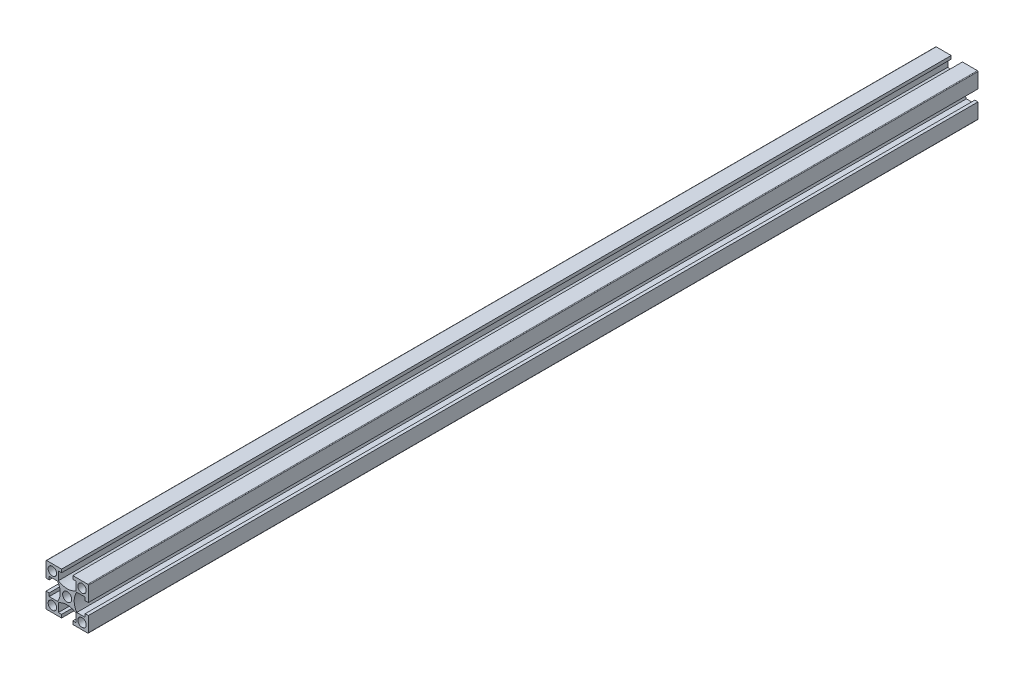
from build123d import *

# Parameters (mm, degrees)
SKETCH_1_W               = 20
SKETCH_1_H               = 20
SKETCH_1_R               = 2
SKETCH_1_R_2             = 2.15
EXTRUDE_1_DEPTH          = 420
CUT_EXTRUDE_1_REACH      = 422.238
PATTERN_CIRCULAR_1_COUNT = 4
FILLET_1_R               = 0.3


with BuildPart() as part:
    # 스케치1 → 보스-돌출1 (new body)
    with BuildSketch(Plane.XY):
        Rectangle(SKETCH_1_W, SKETCH_1_H)
        with Locations((-7, -7)):
            Circle(SKETCH_1_R, mode=Mode.SUBTRACT)
        with Locations((7, -7)):
            Circle(SKETCH_1_R, mode=Mode.SUBTRACT)
        with Locations((-7, 7)):
            Circle(SKETCH_1_R, mode=Mode.SUBTRACT)
        Circle(SKETCH_1_R_2, mode=Mode.SUBTRACT)
        with Locations((7, 7)):
            Circle(SKETCH_1_R, mode=Mode.SUBTRACT)
    extrude(amount=EXTRUDE_1_DEPTH)

    # 스케치1<3> → 컷-돌출1 (cut, up to next)
    with BuildSketch(Plane.XY, mode=Mode.PRIVATE) as cut_extrude_1_sk1:
        with BuildLine():
            Line((-8.5, 2.65), (-10, 2.65))
            Line((-10, 2.65), (-10, -2.65))
            Line((-10, -2.65), (-8.5, -2.65))
            Line((-8.5, -2.65), (-8.5, -4.15))
            Line((-8.5, -4.15), (-4.503166667, -4.15))
            ThreePointArc((-4.503166667, -4.15), (-3.3, 0), (-4.503166667, 4.15))
            Line((-4.503166667, 4.15), (-8.5, 4.15))
            Line((-8.5, 4.15), (-8.5, 2.65))
        make_face()
    cut_extrude_1_tool1 = extrude(cut_extrude_1_sk1.sketch, amount=CUT_EXTRUDE_1_REACH, mode=Mode.PRIVATE) & part.part
    cut_extrude_1 = cut_extrude_1_tool1.solids().sort_by_distance((-6.606913, 0, 0))[0]
    add(cut_extrude_1, mode=Mode.SUBTRACT)

    # 원형 패턴1: 컷-돌출1 ×4 about axis
    pattern_circular_1_axis = Axis((0, 0, 420), (0, 0, -1))
    for i in range(1, PATTERN_CIRCULAR_1_COUNT):
        add(cut_extrude_1.rotate(pattern_circular_1_axis, i * 360 / PATTERN_CIRCULAR_1_COUNT), mode=Mode.SUBTRACT)

    # 필렛1
    fillet_1_edges = [part.edges().sort_by_distance(p)[0] for p in [
        (10, -10, 210),
        (-10, -10, 210),
        (-10, 10, 210),
        (10, 10, 210),
    ]]
    fillet(fillet_1_edges, radius=FILLET_1_R)


solid = part.part
